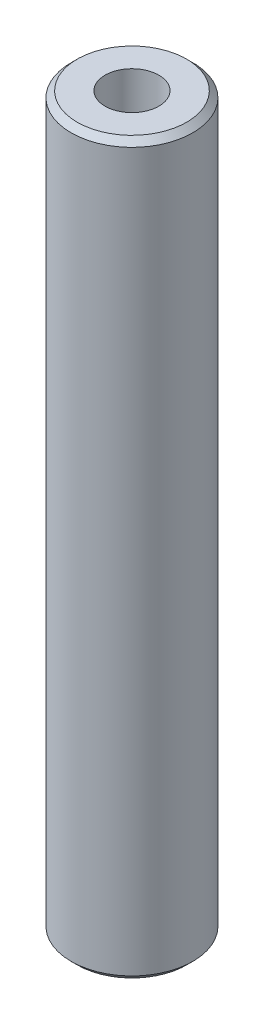
from build123d import *

# Parameters (mm, degrees)
SKETCH1_R           = 50
BOSS_EXTRUDE1_DEPTH = 600
SKETCH2_R           = 22.129791496
CUT_EXTRUDE1_DEPTH  = 605.15229868
CHAMFER1_SIZE       = 5.01823991


with BuildPart() as part:
    # Sketch1 → Boss-Extrude1 (new body)
    with BuildSketch(Plane(origin=(0, 0, 0), x_dir=(1, 0, 0), z_dir=(0, 1, 0))):
        Circle(SKETCH1_R)
    extrude(amount=BOSS_EXTRUDE1_DEPTH)

    # Sketch2 → Cut-Extrude1 (cut, through all)
    with BuildSketch(Plane(origin=(0, 0, 0), x_dir=(1, 0, 0), z_dir=(0, 1, 0))):
        Circle(SKETCH2_R)
    extrude(amount=CUT_EXTRUDE1_DEPTH, mode=Mode.SUBTRACT)

    # Chamfer1
    chamfer1_edges = [part.edges().sort_by_distance(p)[0] for p in [
        (-50, 600, 0),
        (-50, 0, 0),
    ]]
    chamfer(chamfer1_edges, length=CHAMFER1_SIZE)


solid = part.part
